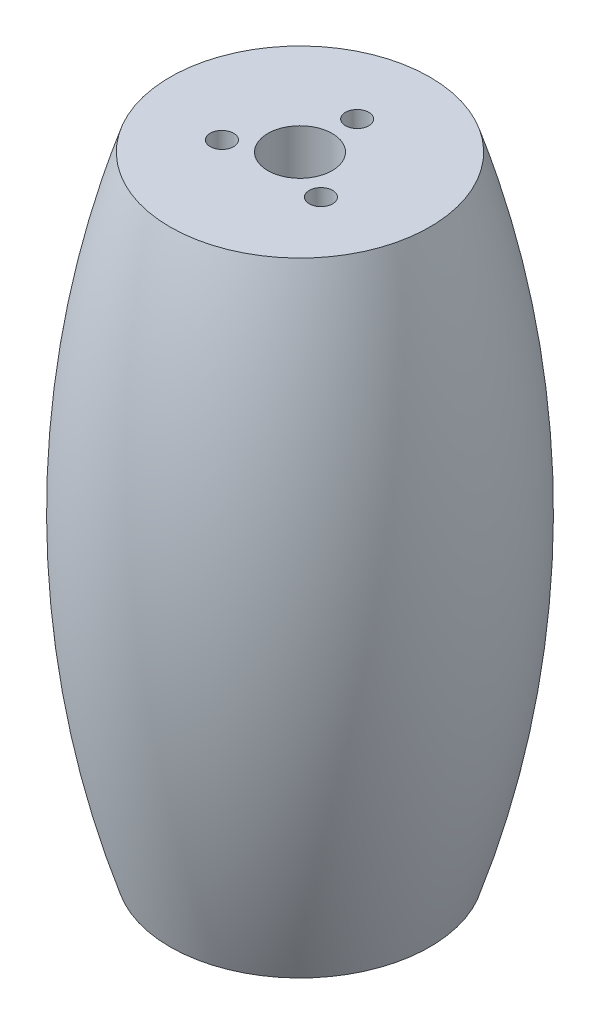
from build123d import *

# Parameters (mm, degrees)
SKETCH_2_R          = 2.25
CUT_EXTRUDE_1_DEPTH = 5
SKETCH_3_R          = 6.2
CUT_EXTRUDE_2_DEPTH = 130.532381548


with BuildPart() as part:
    # ｽｹｯﾁ1 → 回転1 (revolve)
    with BuildSketch(Plane.XY):
        with BuildLine():
            Line((-25, 0), (0, 0))
            Line((0, 0), (0, 120))
            Line((0, 120), (-25, 120))
            ThreePointArc((-25, 120), (-34.486503388, 60), (-25, 0))
        make_face()
    revolve(axis=Axis((0, 0, 0), (0, 1, 0)))

    # ｽｹｯﾁ2 → ｶｯﾄ - 押し出し1 (cut)
    with BuildSketch(Plane(origin=(0, 120, 0), x_dir=(1, 0, 0), z_dir=(0, 1, 0))):
        with Locations((0, 11)):
            Circle(SKETCH_2_R)
        with Locations((9.526279442, -5.5)):
            Circle(SKETCH_2_R)
        with Locations((-9.526279442, -5.5)):
            Circle(SKETCH_2_R)
    cut_extrude_1 = extrude(amount=-CUT_EXTRUDE_1_DEPTH, mode=Mode.SUBTRACT)

    # ﾐﾗｰ1: ｶｯﾄ - 押し出し1 across plane
    add(cut_extrude_1.mirror(Plane.ZX.offset(60)), mode=Mode.SUBTRACT)

    # ｽｹｯﾁ3 → ｶｯﾄ - 押し出し2 (cut, through all)
    with BuildSketch(Plane(origin=(0, 120, 0), x_dir=(1, 0, 0), z_dir=(0, 1, 0))):
        Circle(SKETCH_3_R)
    extrude(amount=-CUT_EXTRUDE_2_DEPTH, mode=Mode.SUBTRACT)


solid = part.part
